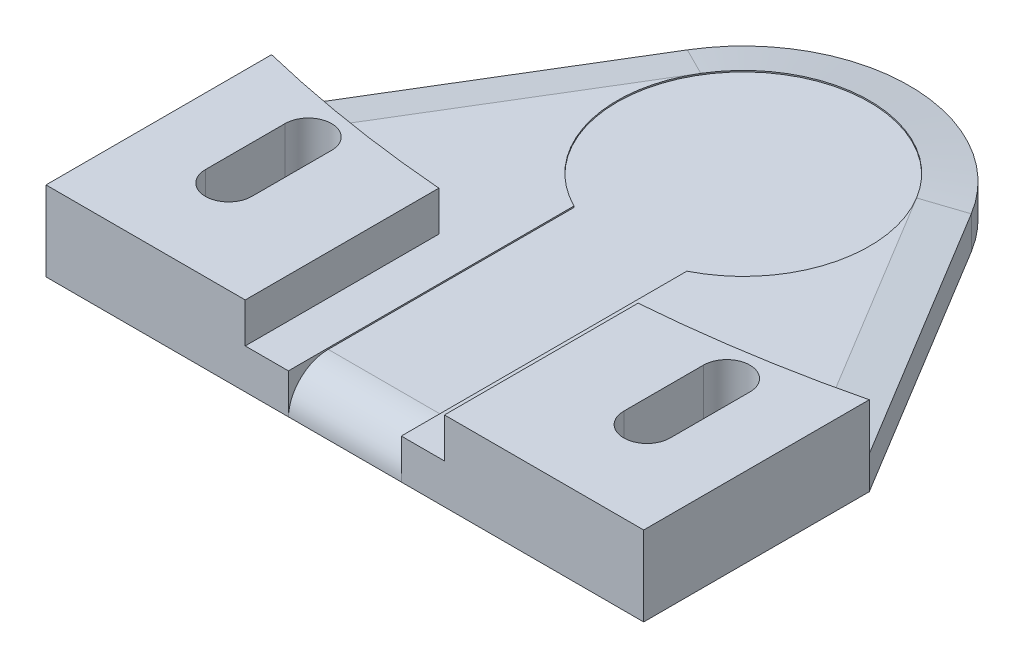
from build123d import *

# Parameters (mm, degrees)
BOSS_EXTRUDE1_DEPTH = 6
BOSS_EXTRUDE2_DEPTH = 3
SKETCH3_W           = 15
SKETCH3_H           = 14.578547678
CUT_EXTRUDE1_DEPTH  = 3
CUT_EXTRUDE2_DEPTH  = 0.1
FILLET1_R           = 3
CHAMFER1_SIZE       = 0.528980942
CHAMFER1_SIZE_2     = 3


with BuildPart() as part:
    # Sketch1 → Boss-Extrude1 (new body)
    with BuildSketch(Plane(origin=(0, 0, 0), x_dir=(1, 0, 0), z_dir=(0, 1, 0))):
        with BuildLine():
            Line((22.5, -167.846096908), (22.5, -150.861139315))
            ThreePointArc((22.5, -150.861139315), (0, -153.564064606), (-22.5, -150.861139315))
            Line((-22.5, -150.861139315), (-22.5, -167.846096908))
            Line((-22.5, -167.846096908), (22.5, -167.846096908))
        make_face()
        with BuildLine():
            Line((-17.5, -154.846096908), (-17.5, -160.846096908))
            ThreePointArc((-17.5, -160.846096908), (-15.75, -162.596096908), (-14, -160.846096908))
            Line((-14, -160.846096908), (-14, -154.846096908))
            ThreePointArc((-14, -154.846096908), (-15.75, -153.096096908), (-17.5, -154.846096908))
        make_face(mode=Mode.SUBTRACT)
        with BuildLine():
            Line((14, -154.846096908), (14, -160.846096908))
            ThreePointArc((14, -160.846096908), (15.75, -162.596096908), (17.5, -160.846096908))
            Line((17.5, -160.846096908), (17.5, -154.846096908))
            ThreePointArc((17.5, -154.846096908), (15.75, -153.096096908), (14, -154.846096908))
        make_face(mode=Mode.SUBTRACT)
    extrude(amount=BOSS_EXTRUDE1_DEPTH)

    # Sketch2 → Boss-Extrude2 (add)
    with BuildSketch(Plane(origin=(0, 0, 0), x_dir=(1, 0, 0), z_dir=(0, 1, 0))):
        with BuildLine():
            Line((-22.5, -167.846096908), (22.5, -167.846096908))
            Line((22.5, -167.846096908), (22.5, -150.861139315))
            Line((22.5, -150.861139315), (10.691043752, -131.369092702))
            ThreePointArc((10.691043752, -131.369092702), (0, -125.346096908), (-10.691043752, -131.369092702))
            Line((-10.691043752, -131.369092702), (-22.5, -150.861139315))
            Line((-22.5, -150.861139315), (-22.5, -167.846096908))
        make_face()
        with BuildLine():
            Line((-17.5, -154.846096908), (-17.5, -160.846096908))
            ThreePointArc((-17.5, -160.846096908), (-15.75, -162.596096908), (-14, -160.846096908))
            Line((-14, -160.846096908), (-14, -154.846096908))
            ThreePointArc((-14, -154.846096908), (-15.75, -153.096096908), (-17.5, -154.846096908))
        make_face(mode=Mode.SUBTRACT)
        with BuildLine():
            Line((14, -154.846096908), (14, -160.846096908))
            ThreePointArc((14, -160.846096908), (15.75, -162.596096908), (17.5, -160.846096908))
            Line((17.5, -160.846096908), (17.5, -154.846096908))
            ThreePointArc((17.5, -154.846096908), (15.75, -153.096096908), (14, -154.846096908))
        make_face(mode=Mode.SUBTRACT)
    extrude(amount=BOSS_EXTRUDE2_DEPTH)

    # Sketch3 → Cut-Extrude1 (cut)
    with BuildSketch(Plane(origin=(0, 6, 0), x_dir=(1, 0, 0), z_dir=(0, 1, 0))):
        with Locations((0, -160.556823069)):
            Rectangle(SKETCH3_W, SKETCH3_H)
    extrude(amount=-CUT_EXTRUDE1_DEPTH, mode=Mode.SUBTRACT)

    # Sketch4 → Cut-Extrude2 (cut)
    with BuildSketch(Plane(origin=(0, 3, 0), x_dir=(1, 0, 0), z_dir=(0, 1, 0))):
        with BuildLine():
            Line((-4.25, -146.342419642), (-4.25, -167.846096908))
            Line((-4.25, -167.846096908), (4.25, -167.846096908))
            Line((4.25, -167.846096908), (4.25, -146.342419642))
            ThreePointArc((4.25, -146.342419642), (0, -128.346096908), (-4.25, -146.342419642))
        make_face()
    extrude(amount=-CUT_EXTRUDE2_DEPTH, mode=Mode.SUBTRACT)

    # Fillet1
    # the kernel refuses this fillet: 3 mm, written as the material it takes off along each edge
    with BuildSketch(Plane(origin=(-4.25, 2.9, 167.846096908), x_dir=(0, -1, 0), z_dir=(1, 0, 0))) as fillet1_piece_1:
        with BuildLine():
            CenterArc((FILLET1_R, FILLET1_R), FILLET1_R, 180, 90)
            Line((0, FILLET1_R), (0, 0))
            Line((0, 0), (FILLET1_R, 0))
        make_face()
    extrude(amount=8.5, mode=Mode.SUBTRACT)

    # Chamfer1
    # the kernel refuses this chamfer: 3, 0.528980942 mm, written as the material it takes off along each edge
    with BuildSketch(Plane(origin=(26.539379212, 3, 157.528601387), x_dir=(0.1797282148286355, -0.9776715712462603, -0.10888557099717337), z_dir=(-0.5181603365296565, 0, -0.8552835001608959))) as chamfer1_piece_1_section:
        Polygon((CHAMFER1_SIZE * 0.977671571478, CHAMFER1_SIZE * 0.210138760817), (-CHAMFER1_SIZE_2 * 0.210138760767, CHAMFER1_SIZE_2 * 0.977671571246), (0, 0), align=None)
    chamfer1_piece_1 = extrude(amount=30.585774986, mode=Mode.PRIVATE)
    chamfer1_piece_1 = chamfer1_piece_1 & Plane(origin=(0, 2.81678549, 58.564064606), x_dir=(0.23684210526315766, 0, 0.9715481548407755), z_dir=(0, -1, 0)) * Cylinder(95, 73, mode=Mode.PRIVATE)
    add(chamfer1_piece_1, mode=Mode.SUBTRACT)
    with BuildSketch(Plane(origin=(0, 3, 137.846096908), x_dir=(0.8552835001609747, 0, -0.5181603365295261), z_dir=(0.5181603365295261, 0, 0.8552835001609747))) as chamfer1_piece_2:
        Polygon((12.5, -CHAMFER1_SIZE), (12.5 - CHAMFER1_SIZE_2, 0), (12.5, 0), align=None)
    revolve(axis=Axis((0, 3, 137.846096908), (0, 1, 0)), revolution_arc=117.582137566, mode=Mode.SUBTRACT)
    with BuildSketch(Plane(origin=(-10.691043752, 3, 131.369092702), x_dir=(0.8552644030796279, 0.0066825316561016845, 0.5181487668570801), z_dir=(-0.5181603365296562, 0, 0.855283500160896))) as chamfer1_piece_3_section:
        Polygon((CHAMFER1_SIZE_2 * 0.999977671636, -CHAMFER1_SIZE_2 * 0.0066825316561), (-CHAMFER1_SIZE * 0.00668253165769, -CHAMFER1_SIZE * 0.999977671873), (0, 0), align=None)
    chamfer1_piece_3 = extrude(amount=30.585774986, mode=Mode.PRIVATE)
    chamfer1_piece_3 = chamfer1_piece_3 & Plane(origin=(0, 2.847950314, 58.564064606), x_dir=(0.23684210526315766, 0, 0.9715481548407755), z_dir=(0, -1, 0)) * Cylinder(95, 74, mode=Mode.PRIVATE)
    add(chamfer1_piece_3, mode=Mode.SUBTRACT)


solid = part.part
